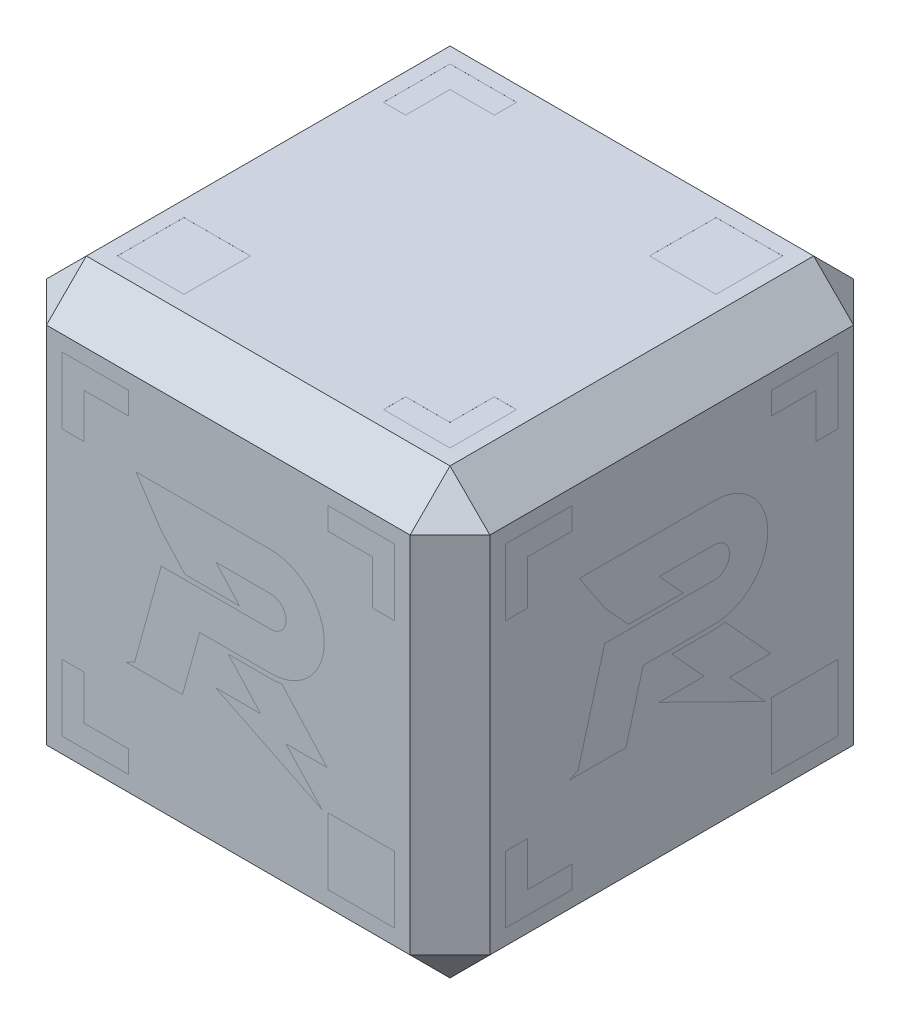
from build123d import *

# Parameters (mm, degrees)
EXTRUDE_1_DEPTH          = 164
SKETCH_2_W               = 164
SKETCH_2_H               = 164
EXTRUDE_2_DEPTH          = 18
CHAMFER_2_SIZE           = 18
CHAMFER_6_SIZE           = 18
EXTRUDE_3_DEPTH          = 164
EXTRUDE_4_DEPTH          = 164
SKETCH_6_W               = 164
SKETCH_6_H               = 164
EXTRUDE_5_DEPTH          = 18
CHAMFER_7_SIZE           = 18
CHAMFER_8_SIZE           = 18
EXTRUDE_6_DEPTH          = 164
EXTRUDE_7_DEPTH          = 164
EXTRUDE_8_DEPTH          = 164
EXTRUDE_9_DEPTH          = 164
EXTRUDE_10_DEPTH         = 164
EXTRUDE_11_DEPTH         = 164
EXTRUDE_12_DEPTH         = 164
EXTRUDE_13_DEPTH         = 164
EXTRUDE_14_DEPTH         = 164
SKETCH_16_W              = 30
SKETCH_16_H              = 30
CUT_EXTRUDE_1_DEPTH      = 8
SKETCH_17_W              = 30
SKETCH_17_H              = 30
CUT_EXTRUDE_2_DEPTH      = 0.01
SKETCH_18_W              = 30
SKETCH_18_H              = 30
CUT_EXTRUDE_3_DEPTH      = 8
SKETCH_19_W              = 30
SKETCH_19_H              = 30
CUT_EXTRUDE_4_DEPTH      = 8
SKETCH_20_W              = 30
SKETCH_20_H              = 30
CUT_EXTRUDE_5_DEPTH      = 8
SKETCH_21_W              = 30
SKETCH_21_H              = 30
CUT_EXTRUDE_6_DEPTH      = 0.01
CUT_EXTRUDE_8_DEPTH      = 8
PATTERN_CIRCULAR_1_COUNT = 4
EXTRUDE_15_DEPTH         = 8
EXTRUDE_15_2_DEPTH       = 8
EXTRUDE_15_3_DEPTH       = 8
EXTRUDE_15_4_DEPTH       = 8
EXTRUDE_15_5_DEPTH       = 8
SKETCH_25_W              = 30
SKETCH_25_H              = 30
EXTRUDE_15_6_DEPTH       = 8
EXTRUDE_16_DEPTH         = 8
EXTRUDE_16_2_DEPTH       = 8
EXTRUDE_16_3_DEPTH       = 8
SKETCH_26_W              = 30
SKETCH_26_H              = 30
EXTRUDE_16_4_DEPTH       = 8
EXTRUDE_16_5_DEPTH       = 8
EXTRUDE_16_6_DEPTH       = 8
EXTRUDE_17_DEPTH         = 8
EXTRUDE_17_2_DEPTH       = 8
EXTRUDE_17_3_DEPTH       = 8
EXTRUDE_17_4_DEPTH       = 8
SKETCH_27_W              = 30
SKETCH_27_H              = 30
EXTRUDE_17_5_DEPTH       = 8
EXTRUDE_17_6_DEPTH       = 8
EXTRUDE_23_DEPTH         = 8
EXTRUDE_23_2_DEPTH       = 8
EXTRUDE_23_3_DEPTH       = 8
SKETCH_35_W              = 30
SKETCH_35_H              = 30
EXTRUDE_23_4_DEPTH       = 8
EXTRUDE_24_DEPTH         = 8
EXTRUDE_24_2_DEPTH       = 8
SKETCH_37_W              = 50
SKETCH_37_H              = 7.5
SKETCH_37_H_2            = 2.5
SKETCH_37_H_3            = 5
CUT_EXTRUDE_13_DEPTH     = 0.01


with BuildPart() as part:
    # 草图1 → 凸台-拉伸1 (new body)
    with BuildSketch(Plane(origin=(0, 0, 0), x_dir=(1, 0, 0), z_dir=(0, 1, 0))):
        Polygon((-82, -100), (82, -100), (100, -82), (100, 82), (82, 100), (-82, 100), (-100, 82), (-100, -82), align=None)
    extrude(amount=EXTRUDE_1_DEPTH)

    # 草图2 → 凸台-拉伸2 (add)
    with BuildSketch(Plane(origin=(0, 164, 0), x_dir=(1, 0, 0), z_dir=(0, 1, 0))):
        Rectangle(SKETCH_2_W, SKETCH_2_H)
    extrude(amount=EXTRUDE_2_DEPTH)

    # 倒角2
    chamfer_2_edges = [part.edges().sort_by_distance(p)[0] for p in [
        (-82, 164, 0),
    ]]
    chamfer(chamfer_2_edges, length=CHAMFER_2_SIZE - 0.0001)  # a hair under: the kernel refuses the full size

    # 倒角6
    chamfer_6_edges = [part.edges().sort_by_distance(p)[0] for p in [
        (82, 164, 0),
    ]]
    chamfer(chamfer_6_edges, length=CHAMFER_6_SIZE - 0.0001)  # a hair under: the kernel refuses the full size

    # 草图4 → 凸台-拉伸3 (add)
    with BuildSketch(Plane(origin=(82, 0, 0), x_dir=(0, 0, -1), z_dir=(1, 0, 0))):
        Polygon((82, 182), (100, 164), (82, 164), align=None)
    extrude(amount=-EXTRUDE_3_DEPTH)

    # 草图5 → 凸台-拉伸4 (add)
    with BuildSketch(Plane(origin=(82, 0, 0), x_dir=(0, 0, -1), z_dir=(1, 0, 0))):
        Polygon((-82, 164), (-82, 182), (-100, 164), align=None)
    extrude(amount=-EXTRUDE_4_DEPTH)

    # 草图6 → 凸台-拉伸5 (add)
    with BuildSketch(Plane(origin=(0, 0, 0), x_dir=(1, 0, 0), z_dir=(0, 1, 0))):
        Rectangle(SKETCH_6_W, SKETCH_6_H)
    extrude(amount=-EXTRUDE_5_DEPTH)

    # 倒角7
    chamfer_7_edges = [part.edges().sort_by_distance(p)[0] for p in [
        (0, 0, -82),
    ]]
    chamfer(chamfer_7_edges, length=CHAMFER_7_SIZE - 0.0001)  # a hair under: the kernel refuses the full size

    # 倒角8
    chamfer_8_edges = [part.edges().sort_by_distance(p)[0] for p in [
        (0, 0, 82),
    ]]
    chamfer(chamfer_8_edges, length=CHAMFER_8_SIZE - 0.0001)  # a hair under: the kernel refuses the full size

    # 草图7 → 凸台-拉伸6 (add)
    with BuildSketch(Plane.XY.offset(82)):
        Polygon((82, -18), (100, 0), (82, 0), align=None)
        Polygon((-82, -18), (-100, 0), (-82, 0), align=None)
    extrude(amount=-EXTRUDE_6_DEPTH)

    # 草图8 → 凸台-拉伸7 (add)
    with BuildSketch(Plane(origin=(-60.666666667, -60.666666667, 60.666666667), x_dir=(-0.8164965809277263, 0.4082482904638628, -0.40824829046386313), z_dir=(0.5773502691896256, 0.577350269189626, -0.5773502691896258))):
        Polygon((26.12789059, 45.254833996), (48.173298275, 57.982756057), (26.12789059, 70.710678119), align=None)
    extrude(amount=EXTRUDE_7_DEPTH)

    # 草图9 → 凸台-拉伸8 (add)
    with BuildSketch(Plane(origin=(-60.666666667, -60.666666667, -60.666666667), x_dir=(-0.8164965809277265, 0.40824829046386285, 0.4082482904638624), z_dir=(-0.5773502691896252, -0.5773502691896263, -0.5773502691896258))):
        Polygon((26.12789059, 45.254833996), (48.173298275, 57.982756057), (26.12789059, 70.710678119), align=None)
    extrude(amount=-EXTRUDE_8_DEPTH)

    # 草图10 → 凸台-拉伸9 (add)
    with BuildSketch(Plane(origin=(60.666666667, -60.666666667, -60.666666667), x_dir=(-0.8164965809277259, -0.4082482904638633, -0.408248290463863), z_dir=(0.577350269189626, -0.577350269189626, -0.5773502691896255))):
        Polygon((-26.12789059, 45.254833996), (-26.12789059, 70.710678119), (-48.173298275, 57.982756057), align=None)
    extrude(amount=-EXTRUDE_9_DEPTH)

    # 草图11 → 凸台-拉伸10 (add)
    with BuildSketch(Plane(origin=(60.666666667, -60.666666667, 60.666666667), x_dir=(-0.4082482904638633, 0.40824829046386274, 0.8164965809277261), z_dir=(-0.5773502691896262, 0.5773502691896254, -0.5773502691896257))):
        Polygon((26.12789059, 45.254833996), (26.12789059, 70.710678119), (48.173298275, 57.982756057), align=None)
    extrude(amount=EXTRUDE_10_DEPTH)

    # 草图12 → 凸台-拉伸11 (add)
    with BuildSketch(Plane(origin=(-115.333333333, 115.333333333, -115.333333333), x_dir=(0.8164965809277263, 0.40824829046386296, -0.4082482904638627), z_dir=(-0.5773502691896255, 0.5773502691896262, -0.5773502691896257))):
        Polygon((40.824829046, -70.710678119), (40.824829046, -45.254833996), (18.779421361, -57.982756057), align=None)
    extrude(amount=-EXTRUDE_11_DEPTH)

    # 草图13 → 凸台-拉伸12 (add)
    with BuildSketch(Plane(origin=(115.333333333, 115.333333333, 115.333333333), x_dir=(-0.8164965809277261, 0.408248290463863, 0.408248290463863), z_dir=(-0.5773502691896257, -0.5773502691896258, -0.5773502691896258))):
        Polygon((40.824829046, 70.710678119), (18.779421361, 57.982756057), (40.824829046, 45.254833996), align=None)
    extrude(amount=EXTRUDE_12_DEPTH)

    # 草图14 → 凸台-拉伸13 (add)
    with BuildSketch(Plane(origin=(115.333333333, 115.333333333, -115.333333333), x_dir=(-0.8164965809277261, 0.40824829046386324, -0.40824829046386263), z_dir=(-0.5773502691896256, -0.577350269189626, 0.5773502691896257))):
        Polygon((40.824829046, -70.710678119), (18.779421361, -57.982756057), (40.824829046, -45.254833996), align=None)
    extrude(amount=EXTRUDE_13_DEPTH)

    # 草图15 → 凸台-拉伸14 (add)
    with BuildSketch(Plane(origin=(-115.333333333, 115.333333333, 115.333333333), x_dir=(0.8164965809277261, 0.4082482904638632, 0.4082482904638629), z_dir=(-0.5773502691896258, 0.5773502691896261, 0.5773502691896256))):
        Polygon((40.824829046, 70.710678119), (18.779421361, 57.982756057), (40.824829046, 45.254833996), align=None)
    extrude(amount=-EXTRUDE_14_DEPTH)

    # 草图16 → 切除-拉伸1 (cut)
    with BuildSketch(Plane(origin=(100, 0, 0), x_dir=(0, 0, -1), z_dir=(1, 0, 0))):
        Polygon((-75, 157), (-75, 127), (-65, 127), (-65, 147), (-45, 147), (-45, 157), align=None)
        Polygon((-75, 7), (-75, 37), (-65, 37), (-65, 17), (-45, 17), (-45, 7), align=None)
        Polygon((75, 157), (75, 127), (65, 127), (65, 147), (45, 147), (45, 157), align=None)
        with Locations((60, 22)):
            Rectangle(SKETCH_16_W, SKETCH_16_H)
    extrude(amount=-CUT_EXTRUDE_1_DEPTH, mode=Mode.SUBTRACT)

    # 草图17 → 切除-拉伸2 (cut)
    with BuildSketch(Plane(origin=(0, 182, 0), x_dir=(1, 0, 0), z_dir=(0, 1, 0))):
        with Locations((-60, -60)):
            Rectangle(SKETCH_17_W, SKETCH_17_H)
        with Locations((60, 60)):
            Rectangle(SKETCH_17_W, SKETCH_17_H)
        Polygon((75, -75), (75, -45), (65, -45), (65, -65), (45, -65), (45, -75), align=None)
        Polygon((-75, 75), (-45, 75), (-45, 65), (-65, 65), (-65, 45), (-75, 45), align=None)
    extrude(amount=-CUT_EXTRUDE_2_DEPTH, mode=Mode.SUBTRACT)

    # 草图18 → 切除-拉伸3 (cut)
    with BuildSketch(Plane(origin=(0, 0, -100), x_dir=(-1, 0, 0), z_dir=(0, 0, -1))):
        Polygon((-75, 157), (-75, 127), (-65, 127), (-65, 147), (-45, 147), (-45, 157), align=None)
        Polygon((75, 157), (75, 127), (65, 127), (65, 147), (45, 147), (45, 157), align=None)
        Polygon((-75, 7), (-45, 7), (-45, 17), (-65, 17), (-65, 37), (-75, 37), align=None)
        with Locations((60, 22)):
            Rectangle(SKETCH_18_W, SKETCH_18_H)
    extrude(amount=-CUT_EXTRUDE_3_DEPTH, mode=Mode.SUBTRACT)

    # 草图19 → 切除-拉伸4 (cut)
    with BuildSketch(Plane.ZY.offset(100)):
        Polygon((-75, 157), (-45, 157), (-45, 147), (-65, 147), (-65, 127), (-75, 127), align=None)
        Polygon((-75, 7), (-45, 7), (-45, 17), (-65, 17), (-65, 37), (-75, 37), align=None)
        Polygon((75, 157), (75, 127), (65, 127), (65, 147), (45, 147), (45, 157), align=None)
        with Locations((60, 22)):
            Rectangle(SKETCH_19_W, SKETCH_19_H)
    extrude(amount=-CUT_EXTRUDE_4_DEPTH, mode=Mode.SUBTRACT)

    # 草图20 → 切除-拉伸5 (cut)
    with BuildSketch(Plane.XY.offset(100)):
        Polygon((-75, 157), (-45, 157), (-45, 147), (-65, 147), (-65, 127), (-75, 127), align=None)
        Polygon((-75, 7), (-45, 7), (-45, 17), (-65, 17), (-65, 37), (-75, 37), align=None)
        Polygon((75, 157), (75, 127), (65, 127), (65, 147), (45, 147), (45, 157), align=None)
        with Locations((60, 22)):
            Rectangle(SKETCH_20_W, SKETCH_20_H)
    extrude(amount=-CUT_EXTRUDE_5_DEPTH, mode=Mode.SUBTRACT)

    # 草图21 → 切除-拉伸6 (cut)
    with BuildSketch(Plane.XZ.offset(18)):
        Polygon((-75, -75), (-75, -45), (-65, -45), (-65, -65), (-45, -65), (-45, -75), align=None)
        with Locations((60, -60)):
            Rectangle(SKETCH_21_W, SKETCH_21_H)
        with Locations((-60, 60)):
            Rectangle(SKETCH_21_W, SKETCH_21_H)
        Polygon((75, 75), (75, 45), (65, 45), (65, 65), (45, 65), (45, 75), align=None)
    extrude(amount=-CUT_EXTRUDE_6_DEPTH, mode=Mode.SUBTRACT)

    # 草图24 → 切除-拉伸8 (cut)
    with BuildSketch(Plane.ZY.offset(100)):
        with BuildLine():
            Line((-12.87388958, 78.531626695), (19.142339459, 78.531063436))
            ThreePointArc((19.142339459, 78.531063436), (43.308110861, 102.696409695), (19.142764602, 126.862181097))
            Line((19.142764602, 126.862181097), (-41.659644792, 126.862181097))
            Line((-41.659644792, 126.862181097), (-30.221102106, 109.611287212))
            Line((-30.221102106, 109.611287212), (-19.47425118, 97.84351502))
            Line((-19.47425118, 97.84351502), (5.11967172, 97.84351502))
            Line((5.11967172, 97.84351502), (-5.58831379, 109.611005579))
            Line((-5.58831379, 109.611005579), (19.142764602, 109.611005579))
            ThreePointArc((19.142764602, 109.611005579), (26.058843363, 102.698319372), (19.146157157, 95.782240611))
            Line((19.146157157, 95.782240611), (-30.221102106, 95.75801847))
            Line((-30.221102106, 95.75801847), (-42.224038231, 52.206221327))
            Line((-42.224038231, 52.206221327), (-46.231118998, 50.331950698))
            Line((-46.231118998, 50.331950698), (-20.64556471, 50.331950698))
            Line((-20.64556471, 50.331950698), (-12.87388958, 78.531626695))
        make_face()
        with BuildLine():
            ThreePointArc((19.142764602, 76.470266964), (21.64879206, 76.590271722), (24.1318857, 76.949187778))
            Line((24.1318857, 76.949187778), (44.592994016, 54.464555495))
            Line((44.592994016, 54.464555495), (26.024900472, 54.464555495))
            Line((26.024900472, 54.464555495), (42.336546792, 36.815995175))
            Line((42.336546792, 36.815995175), (-5.707303923, 60.522209431))
            Line((-5.707303923, 60.522209431), (14.609733363, 60.522209431))
            Line((14.609733363, 60.522209431), (0.045340984, 76.470266964))
            Line((0.045340984, 76.470266964), (19.142764602, 76.470266964))
        make_face()
    cut_extrude_8 = extrude(amount=-CUT_EXTRUDE_8_DEPTH, mode=Mode.SUBTRACT)

    # 阵列(圆周)1: 切除-拉伸8 ×4 about axis
    pattern_circular_1_axis = Axis((0, 0, 0), (0, 1, 0))
    for i in range(1, PATTERN_CIRCULAR_1_COUNT):
        add(cut_extrude_8.rotate(pattern_circular_1_axis, i * 360 / PATTERN_CIRCULAR_1_COUNT), mode=Mode.SUBTRACT)

    # 草图37 → 切除-拉伸13 (cut)
    with BuildSketch(Plane.XZ.offset(18)):
        with Locations((0, -36.25)):
            Rectangle(SKETCH_37_W, SKETCH_37_H)
        with Locations((0, -28.75)):
            Rectangle(SKETCH_37_W, SKETCH_37_H_2)
        with Locations((0, -22.5)):
            Rectangle(SKETCH_37_W, SKETCH_37_H_3)
        with Locations((0, -16.25)):
            Rectangle(SKETCH_37_W, SKETCH_37_H_2)
        with Locations((0, -11.25)):
            Rectangle(SKETCH_37_W, SKETCH_37_H_2)
        with Locations((0, -5)):
            Rectangle(SKETCH_37_W, SKETCH_37_H_3)
        with Locations((0, 3.75)):
            Rectangle(SKETCH_37_W, SKETCH_37_H_2)
        with Locations((0, 12.5)):
            Rectangle(SKETCH_37_W, SKETCH_37_H_3)
        with Locations((0, 20)):
            Rectangle(SKETCH_37_W, SKETCH_37_H_3)
        with Locations((0, 28.75)):
            Rectangle(SKETCH_37_W, SKETCH_37_H_2)
        with Locations((0, 37.5)):
            Rectangle(SKETCH_37_W, SKETCH_37_H_3)
    extrude(amount=-CUT_EXTRUDE_13_DEPTH, mode=Mode.SUBTRACT)


with BuildPart() as body_2:
    # 草图25 → 凸台-拉伸15 (new body)
    with BuildSketch(Plane.ZY.offset(92)):
        Polygon((-75, 37), (-75, 7), (-45, 7), (-45, 17), (-65, 17), (-65, 37), align=None)
    extrude(amount=EXTRUDE_15_DEPTH)


with BuildPart() as body_3:
    # 草图25 → Extrude 15 2 (new body)
    with BuildSketch(Plane.ZY.offset(92)):
        Polygon((-75, 157), (-75, 127), (-65, 127), (-65, 147), (-45, 147), (-45, 157), align=None)
    extrude(amount=EXTRUDE_15_2_DEPTH)


with BuildPart() as body_4:
    # 草图25 → Extrude 15 3 (new body)
    with BuildSketch(Plane.ZY.offset(92)):
        Polygon((75, 157), (45, 157), (45, 147), (65, 147), (65, 127), (75, 127), align=None)
    extrude(amount=EXTRUDE_15_3_DEPTH)


with BuildPart() as body_5:
    # 草图25 → Extrude 15 4 (new body)
    with BuildSketch(Plane.ZY.offset(92)):
        with BuildLine():
            Line((19.142764602, 76.470266964), (0.045340984, 76.470266964))
            Line((0.045340984, 76.470266964), (14.609733363, 60.522209431))
            Line((14.609733363, 60.522209431), (-5.707303923, 60.522209431))
            Line((-5.707303923, 60.522209431), (42.336546792, 36.815995175))
            Line((42.336546792, 36.815995175), (26.024900472, 54.464555495))
            Line((26.024900472, 54.464555495), (44.592994016, 54.464555495))
            Line((44.592994016, 54.464555495), (24.1318857, 76.949187778))
            ThreePointArc((24.1318857, 76.949187778), (21.64879206, 76.590271722), (19.142764602, 76.470266964))
        make_face()
    extrude(amount=EXTRUDE_15_4_DEPTH)


with BuildPart() as body_6:
    # 草图25 → Extrude 15 5 (new body)
    with BuildSketch(Plane.ZY.offset(92)):
        with BuildLine():
            Line((-12.87388958, 78.531626695), (19.142339459, 78.531063436))
            ThreePointArc((19.142339459, 78.531063436), (43.308110861, 102.696409695), (19.142764602, 126.862181097))
            Line((19.142764602, 126.862181097), (-41.659644792, 126.862181097))
            Line((-41.659644792, 126.862181097), (-30.221102106, 109.611287212))
            Line((-30.221102106, 109.611287212), (-19.47425118, 97.84351502))
            Line((-19.47425118, 97.84351502), (5.11967172, 97.84351502))
            Line((5.11967172, 97.84351502), (-5.58831379, 109.611005579))
            Line((-5.58831379, 109.611005579), (19.142764602, 109.611005579))
            ThreePointArc((19.142764602, 109.611005579), (26.058843363, 102.698319372), (19.146157157, 95.782240611))
            Line((19.146157157, 95.782240611), (-30.221102106, 95.75801847))
            Line((-30.221102106, 95.75801847), (-42.224038231, 52.206221327))
            Line((-42.224038231, 52.206221327), (-46.231118998, 50.331950698))
            Line((-46.231118998, 50.331950698), (-20.64556471, 50.331950698))
            Line((-20.64556471, 50.331950698), (-12.87388958, 78.531626695))
        make_face()
    extrude(amount=EXTRUDE_15_5_DEPTH)


with BuildPart() as body_7:
    # 草图25 → Extrude 15 6 (new body)
    with BuildSketch(Plane.ZY.offset(92)):
        with Locations((60, 22)):
            Rectangle(SKETCH_25_W, SKETCH_25_H)
    extrude(amount=EXTRUDE_15_6_DEPTH)


with BuildPart() as body_8:
    # 草图26 → 凸台-拉伸16 (new body)
    with BuildSketch(Plane(origin=(0, 0, -92), x_dir=(-1, 0, 0), z_dir=(0, 0, -1))):
        Polygon((-45, 147), (-45, 157), (-75, 157), (-75, 127), (-65, 127), (-65, 147), align=None)
    extrude(amount=EXTRUDE_16_DEPTH)


with BuildPart() as body_9:
    # 草图26 → Extrude 16 2 (new body)
    with BuildSketch(Plane(origin=(0, 0, -92), x_dir=(-1, 0, 0), z_dir=(0, 0, -1))):
        Polygon((-75, 37), (-75, 7), (-45, 7), (-45, 17), (-65, 17), (-65, 37), align=None)
    extrude(amount=EXTRUDE_16_2_DEPTH)


with BuildPart() as body_10:
    # 草图26 → Extrude 16 3 (new body)
    with BuildSketch(Plane(origin=(0, 0, -92), x_dir=(-1, 0, 0), z_dir=(0, 0, -1))):
        with BuildLine():
            Line((19.142764602, 76.470266964), (0.045340984, 76.470266964))
            Line((0.045340984, 76.470266964), (14.609733363, 60.522209431))
            Line((14.609733363, 60.522209431), (-5.707303923, 60.522209431))
            Line((-5.707303923, 60.522209431), (42.336546792, 36.815995175))
            Line((42.336546792, 36.815995175), (26.024900472, 54.464555495))
            Line((26.024900472, 54.464555495), (44.592994016, 54.464555495))
            Line((44.592994016, 54.464555495), (24.1318857, 76.949187778))
            ThreePointArc((24.1318857, 76.949187778), (21.64879206, 76.590271722), (19.142764602, 76.470266964))
        make_face()
    extrude(amount=EXTRUDE_16_3_DEPTH)


with BuildPart() as body_11:
    # 草图26 → Extrude 16 4 (new body)
    with BuildSketch(Plane(origin=(0, 0, -92), x_dir=(-1, 0, 0), z_dir=(0, 0, -1))):
        with Locations((60, 22)):
            Rectangle(SKETCH_26_W, SKETCH_26_H)
    extrude(amount=EXTRUDE_16_4_DEPTH)


with BuildPart() as body_12:
    # 草图26 → Extrude 16 5 (new body)
    with BuildSketch(Plane(origin=(0, 0, -92), x_dir=(-1, 0, 0), z_dir=(0, 0, -1))):
        with BuildLine():
            Line((-12.87388958, 78.531626695), (19.142339459, 78.531063436))
            ThreePointArc((19.142339459, 78.531063436), (43.308110861, 102.696409695), (19.142764602, 126.862181097))
            Line((19.142764602, 126.862181097), (-41.659644792, 126.862181097))
            Line((-41.659644792, 126.862181097), (-30.221102106, 109.611287212))
            Line((-30.221102106, 109.611287212), (-19.47425118, 97.84351502))
            Line((-19.47425118, 97.84351502), (5.11967172, 97.84351502))
            Line((5.11967172, 97.84351502), (-5.58831379, 109.611005579))
            Line((-5.58831379, 109.611005579), (19.142764602, 109.611005579))
            ThreePointArc((19.142764602, 109.611005579), (26.058843363, 102.698319372), (19.146157157, 95.782240611))
            Line((19.146157157, 95.782240611), (-30.221102106, 95.75801847))
            Line((-30.221102106, 95.75801847), (-42.224038231, 52.206221327))
            Line((-42.224038231, 52.206221327), (-46.231118998, 50.331950698))
            Line((-46.231118998, 50.331950698), (-20.64556471, 50.331950698))
            Line((-20.64556471, 50.331950698), (-12.87388958, 78.531626695))
        make_face()
    extrude(amount=EXTRUDE_16_5_DEPTH)


with BuildPart() as body_13:
    # 草图26 → Extrude 16 6 (new body)
    with BuildSketch(Plane(origin=(0, 0, -92), x_dir=(-1, 0, 0), z_dir=(0, 0, -1))):
        Polygon((75, 157), (45, 157), (45, 147), (65, 147), (65, 127), (75, 127), align=None)
    extrude(amount=EXTRUDE_16_6_DEPTH)


with BuildPart() as body_14:
    # 草图27 → 凸台-拉伸17 (new body)
    with BuildSketch(Plane(origin=(92, 0, 0), x_dir=(0, 0, -1), z_dir=(1, 0, 0))):
        Polygon((75, 157), (45, 157), (45, 147), (65, 147), (65, 127), (75, 127), align=None)
    extrude(amount=EXTRUDE_17_DEPTH)


with BuildPart() as body_15:
    # 草图27 → Extrude 17 2 (new body)
    with BuildSketch(Plane(origin=(92, 0, 0), x_dir=(0, 0, -1), z_dir=(1, 0, 0))):
        Polygon((-65, 17), (-65, 37), (-75, 37), (-75, 7), (-45, 7), (-45, 17), align=None)
    extrude(amount=EXTRUDE_17_2_DEPTH)


with BuildPart() as body_16:
    # 草图27 → Extrude 17 3 (new body)
    with BuildSketch(Plane(origin=(92, 0, 0), x_dir=(0, 0, -1), z_dir=(1, 0, 0))):
        Polygon((-75, 127), (-65, 127), (-65, 147), (-45, 147), (-45, 157), (-75, 157), align=None)
    extrude(amount=EXTRUDE_17_3_DEPTH)


with BuildPart() as body_17:
    # 草图27 → Extrude 17 4 (new body)
    with BuildSketch(Plane(origin=(92, 0, 0), x_dir=(0, 0, -1), z_dir=(1, 0, 0))):
        with BuildLine():
            Line((-12.87388958, 78.531626695), (19.142339459, 78.531063436))
            ThreePointArc((19.142339459, 78.531063436), (43.308110861, 102.696409695), (19.142764602, 126.862181097))
            Line((19.142764602, 126.862181097), (-41.659644792, 126.862181097))
            Line((-41.659644792, 126.862181097), (-30.221102106, 109.611287212))
            Line((-30.221102106, 109.611287212), (-19.47425118, 97.84351502))
            Line((-19.47425118, 97.84351502), (5.11967172, 97.84351502))
            Line((5.11967172, 97.84351502), (-5.58831379, 109.611005579))
            Line((-5.58831379, 109.611005579), (19.142764602, 109.611005579))
            ThreePointArc((19.142764602, 109.611005579), (26.058843363, 102.698319372), (19.146157157, 95.782240611))
            Line((19.146157157, 95.782240611), (-30.221102106, 95.75801847))
            Line((-30.221102106, 95.75801847), (-42.224038231, 52.206221327))
            Line((-42.224038231, 52.206221327), (-46.231118998, 50.331950698))
            Line((-46.231118998, 50.331950698), (-20.64556471, 50.331950698))
            Line((-20.64556471, 50.331950698), (-12.87388958, 78.531626695))
        make_face()
    extrude(amount=EXTRUDE_17_4_DEPTH)


with BuildPart() as body_18:
    # 草图27 → Extrude 17 5 (new body)
    with BuildSketch(Plane(origin=(92, 0, 0), x_dir=(0, 0, -1), z_dir=(1, 0, 0))):
        with Locations((60, 22)):
            Rectangle(SKETCH_27_W, SKETCH_27_H)
    extrude(amount=EXTRUDE_17_5_DEPTH)


with BuildPart() as body_19:
    # 草图27 → Extrude 17 6 (new body)
    with BuildSketch(Plane(origin=(92, 0, 0), x_dir=(0, 0, -1), z_dir=(1, 0, 0))):
        with BuildLine():
            Line((19.142764602, 76.470266964), (0.045340984, 76.470266964))
            Line((0.045340984, 76.470266964), (14.609733363, 60.522209431))
            Line((14.609733363, 60.522209431), (-5.707303923, 60.522209431))
            Line((-5.707303923, 60.522209431), (42.336546792, 36.815995175))
            Line((42.336546792, 36.815995175), (26.024900472, 54.464555495))
            Line((26.024900472, 54.464555495), (44.592994016, 54.464555495))
            Line((44.592994016, 54.464555495), (24.1318857, 76.949187778))
            ThreePointArc((24.1318857, 76.949187778), (21.64879206, 76.590271722), (19.142764602, 76.470266964))
        make_face()
    extrude(amount=EXTRUDE_17_6_DEPTH)


with BuildPart() as body_20:
    # 草图35 → 凸台-拉伸23 (new body)
    with BuildSketch(Plane.XY.offset(92)):
        Polygon((-75, 37), (-75, 7), (-45, 7), (-45, 17), (-65, 17), (-65, 37), align=None)
    extrude(amount=EXTRUDE_23_DEPTH)


with BuildPart() as body_21:
    # 草图35 → Extrude 23 2 (new body)
    with BuildSketch(Plane.XY.offset(92)):
        Polygon((-75, 157), (-75, 127), (-65, 127), (-65, 147), (-45, 147), (-45, 157), align=None)
    extrude(amount=EXTRUDE_23_2_DEPTH)


with BuildPart() as body_22:
    # 草图35 → Extrude 23 3 (new body)
    with BuildSketch(Plane.XY.offset(92)):
        Polygon((75, 157), (45, 157), (45, 147), (65, 147), (65, 127), (75, 127), align=None)
    extrude(amount=EXTRUDE_23_3_DEPTH)


with BuildPart() as body_23:
    # 草图35 → Extrude 23 4 (new body)
    with BuildSketch(Plane.XY.offset(92)):
        with Locations((60, 22)):
            Rectangle(SKETCH_35_W, SKETCH_35_H)
    extrude(amount=EXTRUDE_23_4_DEPTH)


with BuildPart() as body_24:
    # 草图36 → 凸台-拉伸24 (new body)
    with BuildSketch(Plane.XY.offset(92)):
        with BuildLine():
            Line((19.142764602, 76.470266964), (0.045340984, 76.470266964))
            Line((0.045340984, 76.470266964), (14.609733363, 60.522209431))
            Line((14.609733363, 60.522209431), (-5.707303923, 60.522209431))
            Line((-5.707303923, 60.522209431), (42.336546792, 36.815995175))
            Line((42.336546792, 36.815995175), (26.024900472, 54.464555495))
            Line((26.024900472, 54.464555495), (44.592994016, 54.464555495))
            Line((44.592994016, 54.464555495), (24.1318857, 76.949187778))
            ThreePointArc((24.1318857, 76.949187778), (21.64879206, 76.590271722), (19.142764602, 76.470266964))
        make_face()
    extrude(amount=EXTRUDE_24_DEPTH)


with BuildPart() as body_25:
    # 草图36 → Extrude 24 2 (new body)
    with BuildSketch(Plane.XY.offset(92)):
        with BuildLine():
            Line((-12.87388958, 78.531626695), (19.142339459, 78.531063436))
            ThreePointArc((19.142339459, 78.531063436), (43.308110861, 102.696409695), (19.142764602, 126.862181097))
            Line((19.142764602, 126.862181097), (-41.659644792, 126.862181097))
            Line((-41.659644792, 126.862181097), (-30.221102106, 109.611287212))
            Line((-30.221102106, 109.611287212), (-19.47425118, 97.84351502))
            Line((-19.47425118, 97.84351502), (5.11967172, 97.84351502))
            Line((5.11967172, 97.84351502), (-5.58831379, 109.611005579))
            Line((-5.58831379, 109.611005579), (19.142764602, 109.611005579))
            ThreePointArc((19.142764602, 109.611005579), (26.058843363, 102.698319372), (19.146157157, 95.782240611))
            Line((19.146157157, 95.782240611), (-30.221102106, 95.75801847))
            Line((-30.221102106, 95.75801847), (-42.224038231, 52.206221327))
            Line((-42.224038231, 52.206221327), (-46.231118998, 50.331950698))
            Line((-46.231118998, 50.331950698), (-20.64556471, 50.331950698))
            Line((-20.64556471, 50.331950698), (-12.87388958, 78.531626695))
        make_face()
    extrude(amount=EXTRUDE_24_2_DEPTH)


solid = Compound([part.part, body_2.part, body_3.part, body_4.part, body_5.part, body_6.part, body_7.part, body_8.part, body_9.part, body_10.part, body_11.part, body_12.part, body_13.part, body_14.part, body_15.part, body_16.part, body_17.part, body_18.part, body_19.part, body_20.part, body_21.part, body_22.part, body_23.part, body_24.part, body_25.part])
